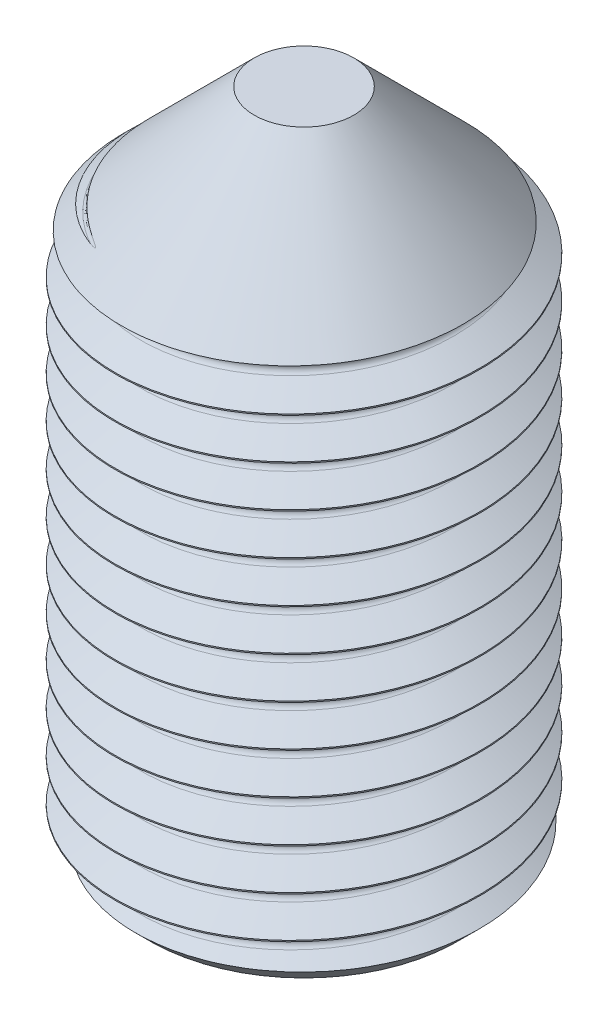
from build123d import *

# Parameters (mm, degrees)
SKETCH1_R           = 11
BOSS_EXTRUDE1_DEPTH = 20
CUT_EXTRUDE1_DEPTH  = 11
CUT_SWEEP1_PITCH    = 2.5
SKETCH6_R           = 7.043673284
CUT_EXTRUDE2_DEPTH  = 1.5
CUT_EXTRUDE2_DRAFT  = -75


with BuildPart() as part:
    # Sketch1 → Boss-Extrude1 (new, symmetric)
    with BuildSketch(Plane(origin=(0, 0, 0), x_dir=(1, 0, 0), z_dir=(0, 1, 0))):
        with Locations(Location((0, 0, 0), (0, 0, 270))):
            Circle(SKETCH1_R)
    extrude(amount=BOSS_EXTRUDE1_DEPTH, both=True)

    # Sketch2 → Cut-Revolve1 (revolve, cut)
    with BuildSketch(Plane.XY, mode=Mode.PRIVATE) as cut_revolve1_sk:
        Polygon((3, 20), (19.65821077, 3.34178923), (19.65821077, -9.64178923), (9.3, -20), (9.3, -23.286747389), (28.429234672, -23.286747389), (28.429234672, 30.873923633), (3, 30.873923633), align=None)
    revolve(cut_revolve1_sk.sketch.rotate(Axis((0, 0, 0), (0, -1, 0)), 270), axis=Axis((0, 0, 0), (0, -1, 0)), mode=Mode.SUBTRACT)

    # Sketch3 → Cut-Extrude1 (cut)
    with BuildSketch(Plane.XZ.offset(20)):
        Polygon((6.1, -3.521836642), (6.1, 3.521836642), (0, 7.043673284), (-6.1, 3.521836642), (-6.1, -3.521836642), (0, -7.043673284), align=None)
    extrude(amount=-CUT_EXTRUDE1_DEPTH, mode=Mode.SUBTRACT)

    # Cut-Sweep1: the profile of Sketch5 screwed along a right-hand helix of 14.5 turns, 10 arcs to a turn; built about Z, then put on its axis
    cut_sweep1_z = Axis((0, 0, 0), (0, 0, 1))
    cut_sweep1_corners = [(-11.062632198, 0, 0.950761815), (-9.439559714, 0, 0.013680479), (-9.259184714, 0, -0.298738185), (-9.439559714, 0, -0.611156849), (-11.062632198, 0, -1.548238185)]
    with BuildLine(mode=Mode.PRIVATE) as cut_sweep1_profile:
        Line(cut_sweep1_corners[0], cut_sweep1_corners[1])
        Line(cut_sweep1_corners[3], cut_sweep1_corners[4])
        Line(cut_sweep1_corners[4], cut_sweep1_corners[0])
        ThreePointArc((-9.439559714, 0, 0.013680479), (-9.30751605, 0, -0.118363185), (-9.259184714, 0, -0.298738185))
        ThreePointArc((-9.259184714, 0, -0.298738185), (-9.30751605, 0, -0.479113185), (-9.439559714, 0, -0.611156849))
    cut_sweep1_cap = Face(cut_sweep1_profile.wire())
    cut_sweep1_arcs = [((-9.439559714, 0, 0.013680479), (-9.259184714, 0, -0.090459075), (-9.259184714, 0, -0.298738185), (1, 0.8660254037844406, 1)), ((-9.259184714, 0, -0.298738185), (-9.259184714, 0, -0.507017295), (-9.439559714, 0, -0.611156849), (1, 0.8660254037844406, 1))]  # start, shoulder, end, weights
    cut_sweep1_turn_angles = [0, 18, 36, 54, 72, 90, 108, 126, 144, 162, 180, 198, 216, 234, 252, 270, 288, 306, 324, 342, 360]
    cut_sweep1_turn_weights = [1, 0.9510565162951535, 1, 0.9510565162951535, 1, 0.9510565162951535, 1, 0.9510565162951535, 1, 0.9510565162951535, 1, 0.9510565162951535, 1, 0.9510565162951535, 1, 0.9510565162951535, 1, 0.9510565162951535, 1, 0.9510565162951535, 1]
    cut_sweep1_turn_rails = [Edge.make_bspline([Vector(p[0], p[1], 0).rotate(cut_sweep1_z, cut_sweep1_turn_angles[k]) / cut_sweep1_turn_weights[k] + Vector(0, 0, p[2] + CUT_SWEEP1_PITCH * cut_sweep1_turn_angles[k] / 360) for k in range(21)], [0, 0, 0, 1, 1, 2, 2, 3, 3, 4, 4, 5, 5, 6, 6, 7, 7, 8, 8, 9, 9, 10, 10, 10], 2, cut_sweep1_turn_weights) for p in cut_sweep1_corners]
    cut_sweep1_turn_sides = [*[Face.make_surface_from_curves(cut_sweep1_turn_rails[p[0]], cut_sweep1_turn_rails[p[1]]) for p in [(0, 1), (3, 4), (4, 0)]], *[Face.make_bezier_surface([[Vector(p[j][0], p[j][1], 0).rotate(cut_sweep1_z, cut_sweep1_turn_angles[2 * i + k]) / cut_sweep1_turn_weights[2 * i + k] + Vector(0, 0, p[j][2] + CUT_SWEEP1_PITCH * cut_sweep1_turn_angles[2 * i + k] / 360) for k in range(3)] for j in range(3)], [[p[3][j] * cut_sweep1_turn_weights[2 * i + k] for k in range(3)] for j in range(3)]) for p in cut_sweep1_arcs for i in range(10)]]
    cut_sweep1_last_angles = [5040, 5058, 5076, 5094, 5112, 5130, 5148, 5166, 5184, 5202, 5220]
    cut_sweep1_last_weights = [1, 0.9510565162951535, 1, 0.9510565162951535, 1, 0.9510565162951535, 1, 0.9510565162951535, 1, 0.9510565162951535, 1]
    cut_sweep1_last_rails = [Edge.make_bspline([Vector(p[0], p[1], 0).rotate(cut_sweep1_z, cut_sweep1_last_angles[k]) / cut_sweep1_last_weights[k] + Vector(0, 0, p[2] + CUT_SWEEP1_PITCH * cut_sweep1_last_angles[k] / 360) for k in range(11)], [0, 0, 0, 1, 1, 2, 2, 3, 3, 4, 4, 5, 5, 5], 2, cut_sweep1_last_weights) for p in cut_sweep1_corners]
    cut_sweep1_last_sides = [*[Face.make_surface_from_curves(cut_sweep1_last_rails[p[0]], cut_sweep1_last_rails[p[1]]) for p in [(0, 1), (3, 4), (4, 0)]], *[Face.make_bezier_surface([[Vector(p[j][0], p[j][1], 0).rotate(cut_sweep1_z, cut_sweep1_last_angles[2 * i + k]) / cut_sweep1_last_weights[2 * i + k] + Vector(0, 0, p[j][2] + CUT_SWEEP1_PITCH * cut_sweep1_last_angles[2 * i + k] / 360) for k in range(3)] for j in range(3)], [[p[3][j] * cut_sweep1_last_weights[2 * i + k] for k in range(3)] for j in range(3)]) for p in cut_sweep1_arcs for i in range(5)]]
    cut_sweep1 = Plane(origin=(0, -20, 0), x_dir=(-1, 0, 0), z_dir=(0, 1, 0)) * Solid(Shell([*[p.moved(Location((0, 0, CUT_SWEEP1_PITCH * i))) for i in range(14) for p in cut_sweep1_turn_sides], *cut_sweep1_last_sides, cut_sweep1_cap, cut_sweep1_cap.rotate(cut_sweep1_z, 5220).moved(Location((0, 0, CUT_SWEEP1_PITCH * 5220 / 360)))]))
    add(cut_sweep1, mode=Mode.SUBTRACT)


with BuildPart() as cut_extrude2_tool:
    # Sketch6 → Cut-Extrude2 (with draft: the straight prism first)
    with BuildSketch(Plane.XZ.offset(20)):
        Circle(SKETCH6_R)
    extrude(amount=-CUT_EXTRUDE2_DEPTH)
    # Cut-Extrude2: the draft: its side faces are tilted about the plane it starts from
    cut_extrude2_sides = [cut_extrude2_tool.faces().sort_by_distance(p)[0] for p in [
        (-7.043673284, -19.25, 0),
    ]]
    draft(cut_extrude2_sides, Plane.XZ.offset(20), CUT_EXTRUDE2_DRAFT)


with BuildPart() as part_1:
    add(part.part)

    # Cut-Extrude2: cut by cut_extrude2_tool
    add(cut_extrude2_tool.part, mode=Mode.SUBTRACT)


solid = part_1.part
